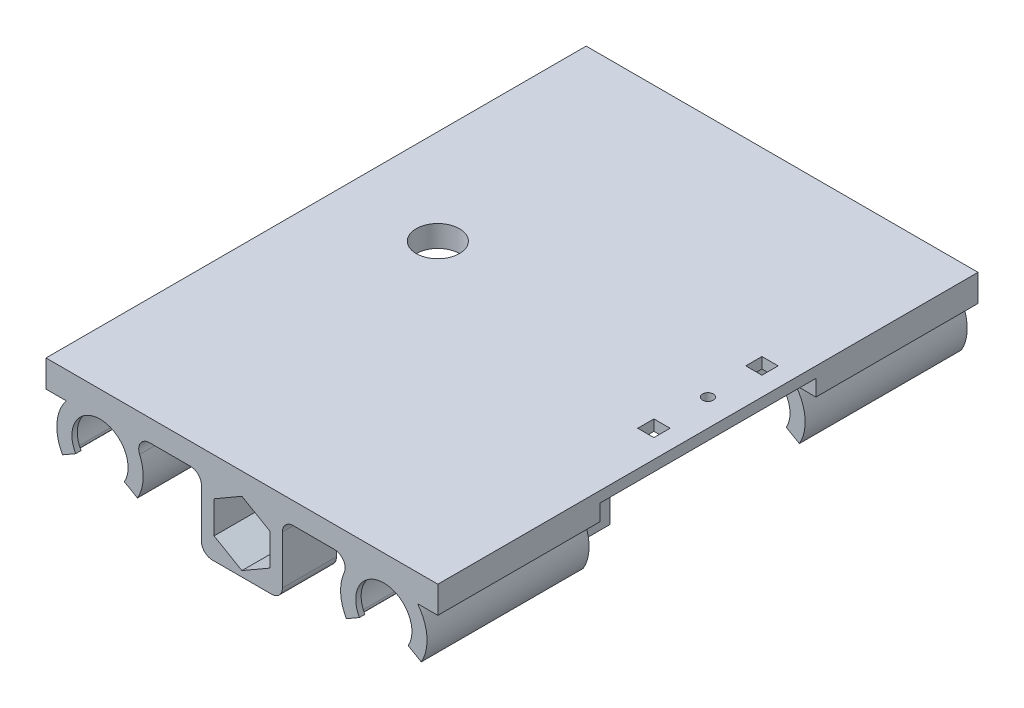
from build123d import *

# Parameters (mm, degrees)
BOSS_EXTRUDE1_DEPTH     = 38.1
BOSS_EXTRUDE2_DEPTH     = 2.54
MIRROR3_COPY_1_DEPTH    = 38.1
BOSS_EXTRUDE3_DEPTH     = 2.54
CHAMFER1_SIZE           = 2.54
FILLET1_R               = 2.54
CUT_EXTRUDE1_DEPTH      = 15.878917544
BOSS_EXTRUDE4_DEPTH     = 15.878917544
SKETCH7_R               = 7.747000000000001
SKETCH7_R_2             = 7.62
CUT_EXTRUDE2_DEPTH      = 157.734
SKETCH8_R               = 7.7470000000000026
BOSS_EXTRUDE6_DEPTH     = 1.27
MIRROR5_COPY_1_SKETCH_R = 7.7470000000000026
MIRROR5_COPY_1_DEPTH    = 1.27
SKETCH10_R              = 6.604
CUT_EXTRUDE3_DEPTH      = 177.29200000000014
MIRROR8_COPY_1_SKETCH_R = 7.7470000000000026
MIRROR8_COPY_1_DEPTH    = 1.27
MIRROR8_COPY_2_SKETCH_R = 7.7470000000000026
MIRROR8_COPY_2_DEPTH    = 1.27
MIRROR8_COPY_3_SKETCH_R = 7.7470000000000026
MIRROR8_COPY_3_DEPTH    = 1.27
FILLET3_R               = 0.635
BOSS_EXTRUDE7_REACH     = 130.655
MIRROR12_COPY_1_REACH   = 130.655
SKETCH12_R              = 5.080000000000001
SKETCH12_W              = 3.8100000000000023
SKETCH12_H              = 3.8100000000000023
SKETCH12_R_2            = 1.2699999999999905
CUT_EXTRUDE4_DEPTH      = 30.45600000000001
BOSS_EXTRUDE9_DEPTH     = 12.7
FILLET5_R               = 2.54
FILLET5_OF_MIRROR14_R   = 2.54
SKETCH15_W              = 27.040839999995164
SKETCH15_H              = 19.05
BOSS_EXTRUDE10_DEPTH    = 35.559999999999995
SKETCH16_R              = 5.080000000000001
CUT_EXTRUDE5_DEPTH      = 35.559999999999995
SKETCH17_R              = 4.6354999999999995
CUT_EXTRUDE6_DEPTH      = 40.385999999999996
CHAMFER2_SIZE           = 10.16


with BuildPart() as part:
    # Sketch1 → Boss-Extrude1 (new body)
    with BuildSketch(Plane.XY):
        with BuildLine():
            Line((-8.79881810244989, -5.080000000000015), (-6.599113576837417, -3.810000000000011))
            ThreePointArc((-6.599113576837502, -3.8099999999998597), (-1.9722011236811299, 7.360354796322719), (7.619999999999998, 0))
            ThreePointArc((7.619999999999998, -1.87e-15), (7.36035479632272, -1.972201123681129), (6.5991135768375, -3.809999999999862))
            Line((6.599113576837415, -3.810000000000005), (8.798818102449891, -5.080000000000009))
            ThreePointArc((8.79881810244989, -5.0800000000000125), (9.813806395096933, -2.629601498241619), (10.16, -2.49e-15))
            ThreePointArc((10.16, 0), (-2.629601498241616, 9.813806395096933), (-8.798818102449891, -5.080000000000009))
        make_face()
    boss_extrude1 = extrude(amount=BOSS_EXTRUDE1_DEPTH)

    # Sketch2 → Boss-Extrude2 (add)
    with BuildSketch(Plane(origin=(0, 10.159999999999998, 0), x_dir=(1, 0, 0), z_dir=(0, 1, 0))):
        Polygon((0, -22.221082455530443), (66.72834, -22.22108245553045), (66.72834, 104.77891754446955), (2.72e-15, 104.77891754446955), align=None)
    extrude(amount=-BOSS_EXTRUDE2_DEPTH)

    # Mirror2: Boss-Extrude1 across plane
    add(boss_extrude1.mirror(Plane.XY.offset(-25.4)))

    # Mirror3: Boss-Extrude1 across plane
    add(boss_extrude1.mirror(Plane(origin=(33.36417, 0, 0), x_dir=(0, 0, 1), z_dir=(1, 0, 0))))

    # Mirror3 copy 1 sketch → Mirror3 copy 1 (add)
    with BuildSketch(Plane(origin=(66.72834, 0, -50.8), x_dir=(-1, 0, 0), z_dir=(0, 0, -1))):
        with BuildLine():
            Line((-8.79881810244989, -5.080000000000015), (-6.599113576837417, -3.810000000000011))
            ThreePointArc((-6.599113576837502, -3.8099999999998597), (-1.9722011236811299, 7.360354796322719), (7.619999999999998, 0))
            ThreePointArc((7.619999999999998, -1.87e-15), (7.36035479632272, -1.972201123681129), (6.5991135768375, -3.809999999999862))
            Line((6.599113576837415, -3.810000000000005), (8.798818102449891, -5.080000000000009))
            ThreePointArc((8.79881810244989, -5.0800000000000125), (9.813806395096933, -2.629601498241619), (10.16, -2.49e-15))
            ThreePointArc((10.16, 0), (-2.629601498241616, 9.813806395096933), (-8.798818102449891, -5.080000000000009))
        make_face()
    extrude(amount=MIRROR3_COPY_1_DEPTH)

    # Sketch4 → Boss-Extrude3 (add)
    with BuildSketch(Plane(origin=(0, 10.159999999999998, 0), x_dir=(1, 0, 0), z_dir=(0, 1, 0))):
        Polygon((79.42834, -22.221082455530443), (-12.700000000000003, -22.221082455530453), (-12.700000000000003, 104.77891754446954), (79.42834, 104.77891754446955), align=None)
    extrude(amount=BOSS_EXTRUDE3_DEPTH)

    # Chamfer1
    # the kernel refuses this chamfer: 2.54 mm, written as the material it takes off along each edge
    with BuildSketch(Plane(origin=(66.72834, 7.619999999999998, 0), x_dir=(0.02749587661058456, 0.9996219169112968, 0), z_dir=(0, 0, -1))) as chamfer1_piece_1_section:
        Polygon((CHAMFER1_SIZE * 0.999621916911, -CHAMFER1_SIZE * 0.0274958766106), (-CHAMFER1_SIZE * 0.0274958766106, -CHAMFER1_SIZE * 0.999621916911), (0, 0), align=None)
    chamfer1_piece_1 = extrude(amount=50.8, mode=Mode.PRIVATE)
    chamfer1_piece_1 = split(chamfer1_piece_1, bisect_by=Plane(origin=(65.88911344802735, 10.159999999999998, -25.4), z_dir=(0, -1, 0)), keep=Keep.TOP, mode=Mode.PRIVATE)
    add(chamfer1_piece_1, mode=Mode.SUBTRACT)
    with BuildSketch(Plane(origin=(1.56e-15, 7.619999999999998, -50.8), x_dir=(0.9996219169112968, -0.027495876610586254, 0), z_dir=(-2e-17, 0, 1))) as chamfer1_piece_2_section:
        Polygon((CHAMFER1_SIZE * 0.999621916911, CHAMFER1_SIZE * 0.0274958766106), (-CHAMFER1_SIZE * 0.0274958766106, CHAMFER1_SIZE * 0.999621916911), (0, 0), align=None)
    chamfer1_piece_2 = extrude(amount=50.8, mode=Mode.PRIVATE)
    chamfer1_piece_2 = split(chamfer1_piece_2, bisect_by=Plane(origin=(0.8392265519726436, 10.159999999999998, -25.400000000000006), z_dir=(0, -1, 0)), keep=Keep.TOP, mode=Mode.PRIVATE)
    add(chamfer1_piece_2, mode=Mode.SUBTRACT)

    # Fillet1
    fillet1_edges = [part.edges().sort_by_distance(p)[0] for p in [
        (6.7202083301040485, 7.619999999999998, 11.110541227765221),
        (6.7202083301040485, 7.619999999999998, -69.85),
        (60.00813166989596, 7.619999999999998, -69.85),
        (60.00813166989596, 7.619999999999998, 11.110541227765225),
    ]]
    fillet(fillet1_edges, radius=FILLET1_R)

    # Sketch5 → Cut-Extrude1 (cut)
    with BuildSketch(Plane(origin=(0, 0, -104.77891754446955), x_dir=(-1, 0, 0), z_dir=(0, 0, -1))):
        Polygon((-79.42834, 12.7), (-79.42834, 10.159999999999998), (-66.72834, 10.159999999999998), (-66.72834, 7.619999999999998), (-2.72e-15, 7.619999999999998), (-2.72e-15, 10.159999999999998), (12.700000000000003, 10.159999999999998), (12.700000000000003, 12.7), align=None)
    extrude(amount=-CUT_EXTRUDE1_DEPTH, mode=Mode.SUBTRACT)

    # Sketch6 → Boss-Extrude4 (add)
    with BuildSketch(Plane.XY.offset(22.221082455530443)):
        with BuildLine():
            Line((-12.700000000000001, 10.159999999999998), (-12.700000000000001, 12.7))
            Line((-12.700000000000001, 12.7), (79.42834, 12.7))
            Line((79.42834, 12.7), (79.42834, 10.159999999999998))
            Line((79.42834, 10.159999999999998), (66.72834, 10.159999999999998))
            Line((66.72834, 10.159999999999998), (57.416546187849725, 4.063999999999999))
            ThreePointArc((57.416546187849725, 4.063999999999999), (57.213714202208706, 6.471215296063113), (55.08859773481217, 7.619999999999998))
            Line((55.08859773481217, 7.619999999999998), (11.639742265187834, 7.619999999999998))
            ThreePointArc((11.639742265187834, 7.619999999999998), (9.514625797791286, 6.471215296063118), (9.311793812150269, 4.063999999999998))
            Line((9.311793812150269, 4.063999999999998), (-3.316e-14, 10.159999999999998))
            Line((-3.316e-14, 10.159999999999998), (-12.700000000000001, 10.159999999999998))
        make_face()
    extrude(amount=BOSS_EXTRUDE4_DEPTH)

    # Sketch7 → Cut-Extrude2 (cut)
    with BuildSketch(Plane(origin=(0, 0, -88.9), x_dir=(-1, 0, 0), z_dir=(0, 0, -1))):
        Circle(SKETCH7_R)
        Circle(SKETCH7_R_2, mode=Mode.SUBTRACT)
    extrude(amount=-CUT_EXTRUDE2_DEPTH, mode=Mode.SUBTRACT)

    # Sketch8 → Boss-Extrude6 (add)
    with BuildSketch(Plane(origin=(0, 0, -88.9), x_dir=(-1, 0, 0), z_dir=(0, 0, -1))):
        Circle(SKETCH8_R)
    boss_extrude6 = extrude(amount=-BOSS_EXTRUDE6_DEPTH)

    # Mirror4: Boss-Extrude6 across plane
    add(boss_extrude6.mirror(Plane.XY.offset(-69.85)))

    # Mirror5: Boss-Extrude6 across plane
    add(boss_extrude6.mirror(Plane.XY.offset(-25.4)))

    # Mirror5 copy 1 sketch → Mirror5 copy 1 (add)
    with BuildSketch(Plane(origin=(0, 0, -1.421e-14), x_dir=(-1, 0, 0), z_dir=(0, 0, -1))):
        Circle(MIRROR5_COPY_1_SKETCH_R)
    extrude(amount=-MIRROR5_COPY_1_DEPTH)

    # Sketch10 → Cut-Extrude3 (cut)
    with BuildSketch(Plane(origin=(0, 0, -88.9), x_dir=(-1, 0, 0), z_dir=(0, 0, -1))):
        with BuildLine():
            ThreePointArc((-6.709098803118043, -3.8735000000000084), (-6.7e-16, -7.747000000000002), (6.709098803118042, -3.87350000000001))
            Line((6.709098803118041, -3.8735000000000115), (5.7192317665924275, -3.3020000000000076))
            ThreePointArc((5.719231766592428, -3.302000000000008), (-1.21e-15, -6.604), (-5.719231766592429, -3.302000000000006))
            Line((-5.719231766592428, -3.3020000000000063), (-6.709098803118043, -3.8735000000000084))
        make_face()
        Circle(SKETCH10_R)
    cut_extrude3 = extrude(amount=-CUT_EXTRUDE3_DEPTH, mode=Mode.SUBTRACT)

    # Mirror8: Boss-Extrude6 across plane
    add(boss_extrude6.mirror(Plane.ZY.offset(-33.36417)))

    # Mirror8 copy 1 sketch → Mirror8 copy 1 (add)
    with BuildSketch(Plane(origin=(66.72834, 0, -50.79999999999998), x_dir=(1, 0, 0), z_dir=(0, 0, 1))):
        Circle(MIRROR8_COPY_1_SKETCH_R)
    extrude(amount=-MIRROR8_COPY_1_DEPTH)

    # Mirror8 copy 2 sketch → Mirror8 copy 2 (add)
    with BuildSketch(Plane(origin=(66.72834, 0, 38.10000000000001), x_dir=(1, 0, 0), z_dir=(0, 0, 1))):
        Circle(MIRROR8_COPY_2_SKETCH_R)
    extrude(amount=-MIRROR8_COPY_2_DEPTH)

    # Mirror8 copy 3 sketch → Mirror8 copy 3 (add)
    with BuildSketch(Plane(origin=(66.72834, 0, -1.421e-14), x_dir=(1, 0, 0), z_dir=(0, 0, -1))):
        Circle(MIRROR8_COPY_3_SKETCH_R)
    extrude(amount=-MIRROR8_COPY_3_DEPTH)

    # Mirror9: Cut-Extrude3 across plane
    add(cut_extrude3.mirror(Plane.ZY.offset(-33.36417)), mode=Mode.SUBTRACT)

    # Fillet3
    fillet3_edges = [part.edges().sort_by_distance(p)[0] for p in [
        (6.709098803118043, -3.8735000000000075, -69.85),
        (-6.709098803118041, -3.8735000000000115, -69.85),
        (-6.709098803118041, -3.8735000000000115, 19.049999999999997),
        (6.709098803118043, -3.8735000000000075, 19.049999999999997),
        (73.32745357683746, -3.8099999999999348, 19.049999999999994),
        (60.12922642316254, -3.8099999999999334, 19.049999999999994),
        (73.32745357683746, -3.8099999999999348, -69.85),
        (60.12922642316254, -3.8099999999999334, -69.85),
    ]]
    fillet(fillet3_edges, radius=FILLET3_R)

    # Sketch11 → Boss-Extrude7 (add, up to next)
    with BuildSketch(Plane.ZY.offset(12.700000000000003), mode=Mode.PRIVATE) as boss_extrude7_sk1:
        Polygon((38.099999999999994, 12.7), (0, 12.7), (7.8e-16, 6.349999999999994), (38.099999999999994, 6.349999999999999), align=None)
    boss_extrude7_tool1 = extrude(boss_extrude7_sk1.sketch, amount=-BOSS_EXTRUDE7_REACH, mode=Mode.PRIVATE) - part.part
    boss_extrude7 = boss_extrude7_tool1.solids().sort_by_distance((-12.7, 9.525, 19.05))[0]
    add(boss_extrude7)

    # Mirror11: Boss-Extrude7 across plane
    add(boss_extrude7.mirror(Plane.XY.offset(-25.4)))

    # Mirror12: Boss-Extrude7 across plane
    add(boss_extrude7.mirror(Plane.ZY.offset(-33.36417)))

    # Mirror12 copy 1 sketch → Mirror12 copy 1 (add, up to next)
    with BuildSketch(Plane(origin=(79.42834, 0, -50.8), x_dir=(0, 0, -1), z_dir=(1, 0, 0)), mode=Mode.PRIVATE) as mirror12_copy_1_sk1:
        Polygon((38.099999999999994, 12.7), (0, 12.7), (7.8e-16, 6.349999999999994), (38.099999999999994, 6.349999999999999), align=None)
    mirror12_copy_1_tool1 = extrude(mirror12_copy_1_sk1.sketch, amount=-MIRROR12_COPY_1_REACH, mode=Mode.PRIVATE) - part.part
    add(mirror12_copy_1_tool1.solids().sort_by_distance((79.42834, 9.525, -69.85))[0])

    # Sketch12 → Cut-Extrude4 (cut)
    with BuildSketch(Plane.XZ.offset(-7.619999999999998)):
        with Locations(Location((9.578340000000019, -31.750000000000007, 0), (0, 0, 270))):
            Circle(SKETCH12_R)
        with Locations((73.07834000000003, -44.44999999999999)):
            Rectangle(SKETCH12_W, SKETCH12_H)
        with Locations(Location((73.07834000000001, -31.750000000000007, 0), (0, 0, 90))):
            Circle(SKETCH12_R_2)
        with Locations((73.07834000000003, -19.049999999999997)):
            Rectangle(SKETCH12_W, SKETCH12_H)
    extrude(amount=-CUT_EXTRUDE4_DEPTH, mode=Mode.SUBTRACT)

    # Sketch14 → Boss-Extrude9 (add)
    with BuildSketch(Plane.XY.offset(38.1)):
        Polygon((23.839499946002224, -8.890000000000004), (23.839499946002228, 7.62), (42.889499946002225, 7.62), (42.889499946002225, -8.890000000000002), align=None)
        Polygon((33.36449994600227, 7.563288526382876), (26.814499946002268, 3.781644263190828), (26.814499946002268, -3.781644263193271), (33.36449994600227, -7.56328852638532), (39.914499946002266, -3.781644263193273), (39.914499946002266, 3.7816442631908296), align=None, mode=Mode.SUBTRACT)
    boss_extrude9 = extrude(amount=-BOSS_EXTRUDE9_DEPTH)

    # Fillet5
    fillet5_edges = [part.edges().sort_by_distance(p)[0] for p in [
        (42.889499946002225, -8.890000000000002, 31.75),
        (23.839499946002224, -8.890000000000004, 31.75),
        (23.839499946002228, 7.62, 31.75),
        (42.889499946002225, 7.62, 31.75),
    ]]
    fillet(fillet5_edges, radius=FILLET5_R)

    # Mirror14: Boss-Extrude9 across plane
    add(boss_extrude9.mirror(Plane.XY.offset(-25.4)))

    # Fillet5 of Mirror14
    fillet5_of_mirror14_edges = [part.edges().sort_by_distance(p)[0] for p in [
        (42.889499946002225, -8.890000000000002, -82.55),
        (23.839499946002224, -8.890000000000004, -82.55),
        (23.839499946002228, 7.62, -82.55),
        (42.889499946002225, 7.62, -82.55),
    ]]
    fillet(fillet5_of_mirror14_edges, radius=FILLET5_OF_MIRROR14_R)

    # Sketch15 → Boss-Extrude10 (add)
    with BuildSketch(Plane.XZ.offset(-7.619999999999998)):
        with Locations((33.36417, -25.4)):
            Rectangle(SKETCH15_W, SKETCH15_H)
    extrude(amount=BOSS_EXTRUDE10_DEPTH)

    # Sketch16 → Cut-Extrude5 (cut)
    with BuildSketch(Plane(origin=(0, 0, -34.925), x_dir=(-1, 0, 0), z_dir=(0, 0, -1))):
        with Locations((-33.36449994600227, -1.22125e-12)):
            Circle(SKETCH16_R)
    extrude(amount=-CUT_EXTRUDE5_DEPTH, mode=Mode.SUBTRACT)

    # Sketch17 → Cut-Extrude6 (cut)
    with BuildSketch(Plane.ZY.offset(-19.843750000002416)):
        with Locations((-25.40000000000009, -20.692530593170666)):
            Circle(SKETCH17_R)
    extrude(amount=-CUT_EXTRUDE6_DEPTH, mode=Mode.SUBTRACT)

    # Chamfer2
    # the kernel refuses this chamfer: 10.16 mm, written as the material it adds along each edge
    with BuildSketch(Plane(origin=(46.88458999999757, 7.619999999999998, -34.925), x_dir=(0, 0.027495876610586355, -0.9996219169112968), z_dir=(-1, 0, 0))) as chamfer2_piece_1_section:
        Polygon((CHAMFER2_SIZE * 0.999621916911, CHAMFER2_SIZE * 0.0274958766106), (-CHAMFER2_SIZE * 0.0274958766106, CHAMFER2_SIZE * 0.999621916911), (0, 0), align=None)
    chamfer2_piece_1 = extrude(amount=27.040839999995157, mode=Mode.PRIVATE)
    chamfer2_piece_1 = chamfer2_piece_1 - Plane(origin=(33.36449994600227, -1.22125e-12, -43.5061832711177), x_dir=(-1, 0, 0), z_dir=(0, 0, -1)) * Cylinder(5.080000000000001, 95, mode=Mode.PRIVATE)
    add(chamfer2_piece_1)
    with BuildSketch(Plane(origin=(19.843750000002416, 7.619999999999998, -15.874999999999996), x_dir=(0, 0.027495876610586355, 0.9996219169112968), z_dir=(1, 0, 0))) as chamfer2_piece_2_section:
        Polygon((CHAMFER2_SIZE * 0.999621916911, CHAMFER2_SIZE * 0.0274958766106), (-CHAMFER2_SIZE * 0.0274958766106, CHAMFER2_SIZE * 0.999621916911), (0, 0), align=None)
    chamfer2_piece_2 = extrude(amount=27.040839999995157, mode=Mode.PRIVATE)
    chamfer2_piece_2 = chamfer2_piece_2 - Plane(origin=(33.36449994600227, -1.22125e-12, -7.2938167251443), x_dir=(-1, 0, 0), z_dir=(0, 0, -1)) * Cylinder(5.080000000000001, 95, mode=Mode.PRIVATE)
    add(chamfer2_piece_2)


solid = part.part
